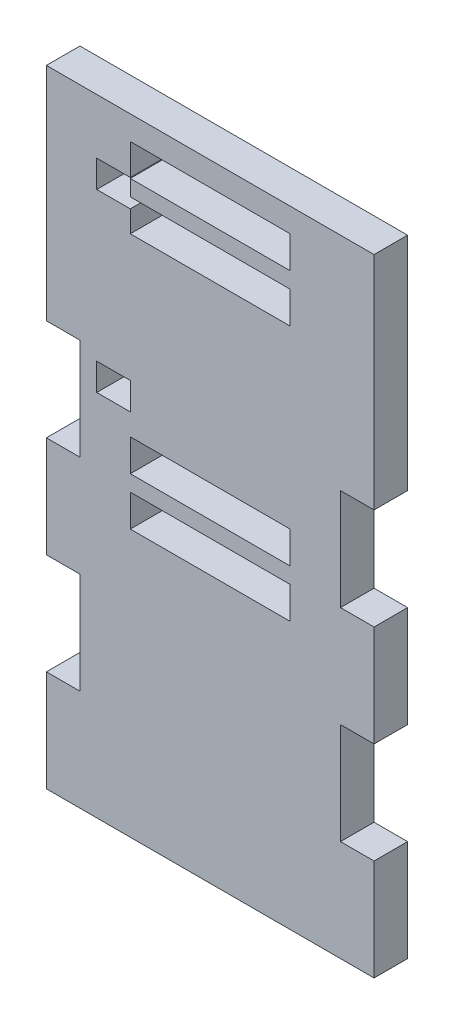
from build123d import *

# Parameters (mm, degrees)
SKETCH1_W           = 52.07
SKETCH1_H           = 80.518
BOSS_EXTRUDE1_DEPTH = 5.334
SKETCH2_W           = 5.334
SKETCH2_H           = 16.1036
CUT_EXTRUDE1_DEPTH  = 57.679185374
SKETCH4_W           = 52.07
SKETCH4_H           = 35.1536
BOSS_EXTRUDE2_DEPTH = 5.334
SKETCH5_W           = 25.4
SKETCH5_H           = 5.08
CUT_EXTRUDE5_DEPTH  = 72.631709324
SKETCH6_W           = 5.334
SKETCH6_H           = 4.318
CUT_EXTRUDE6_DEPTH  = 72.631709324


with BuildPart() as part:
    # Sketch1 → Boss-Extrude1 (new body)
    with BuildSketch(Plane.XY):
        with Locations((-12.912278732, 0.572213281)):
            Rectangle(SKETCH1_W, SKETCH1_H)
    extrude(amount=BOSS_EXTRUDE1_DEPTH)

    # Sketch2 → Cut-Extrude1 (cut, through all)
    with BuildSketch(Plane.XY.offset(5.334)):
        with Locations((-36.280278732, 16.675813281)):
            Rectangle(SKETCH2_W, SKETCH2_H)
        with Locations((-36.280278732, -15.531386719)):
            Rectangle(SKETCH2_W, SKETCH2_H)
        with Locations((10.455721268, -15.531386719)):
            Rectangle(SKETCH2_W, SKETCH2_H)
        with Locations((10.455721268, 16.675813281)):
            Rectangle(SKETCH2_W, SKETCH2_H)
    extrude(amount=-CUT_EXTRUDE1_DEPTH, mode=Mode.SUBTRACT)

    # Sketch4 → Boss-Extrude2 (add)
    with BuildSketch(Plane.XY.offset(5.334)):
        with Locations((-12.912278732, 42.304413281)):
            Rectangle(SKETCH4_W, SKETCH4_H)
    extrude(amount=-BOSS_EXTRUDE2_DEPTH)

    # Sketch5 → Cut-Extrude5 (cut, through all)
    with BuildSketch(Plane.XY.offset(5.334)):
        with Locations((-12.912278732, 12.891213281)):
            Rectangle(SKETCH5_W, SKETCH5_H)
        with Locations((-12.912278732, 53.531213281)):
            Rectangle(SKETCH5_W, SKETCH5_H)
        with Locations((-12.912278732, 45.911213281)):
            Rectangle(SKETCH5_W, SKETCH5_H)
        with Locations((-12.912278732, 5.271213281)):
            Rectangle(SKETCH5_W, SKETCH5_H)
    extrude(amount=-CUT_EXTRUDE5_DEPTH, mode=Mode.SUBTRACT)

    # Sketch6 → Cut-Extrude6 (cut, through all)
    with BuildSketch(Plane.XY.offset(5.334)):
        with Locations((-28.279278732, 48.959213281)):
            Rectangle(SKETCH6_W, SKETCH6_H)
        with Locations((-28.279278732, 21.019213281)):
            Rectangle(SKETCH6_W, SKETCH6_H)
    extrude(amount=-CUT_EXTRUDE6_DEPTH, mode=Mode.SUBTRACT)


solid = part.part
